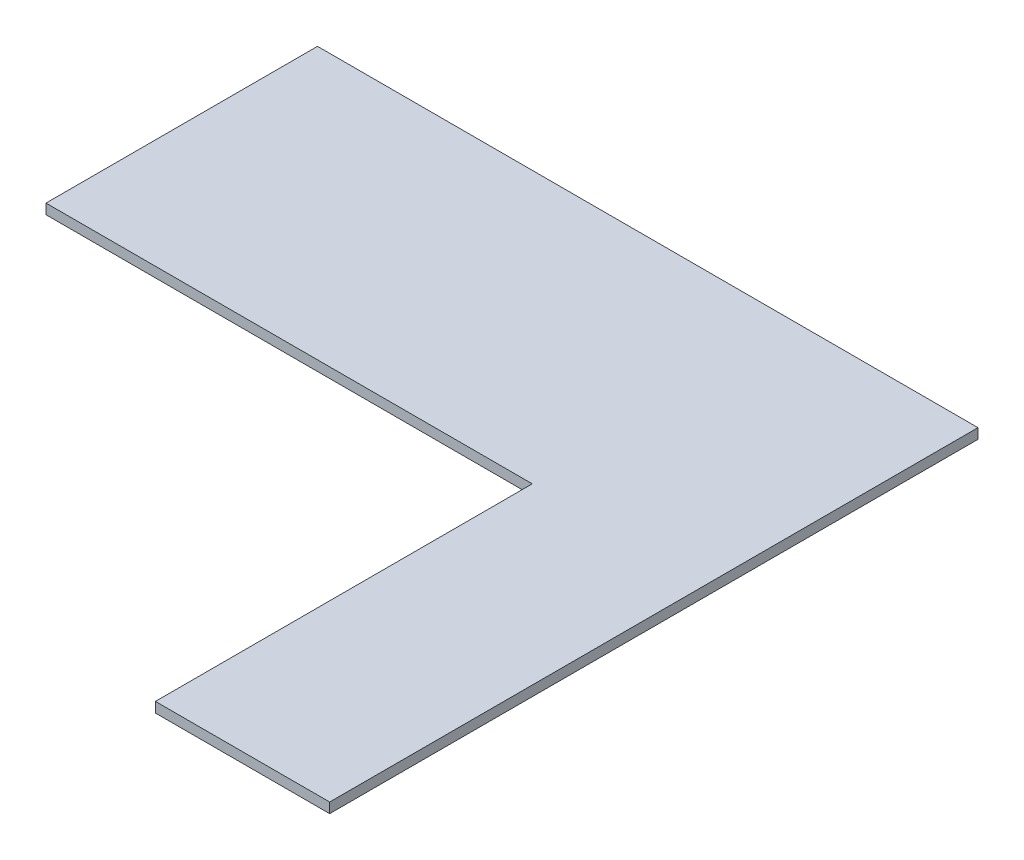
from build123d import *

# Parameters (mm, degrees)
EXTRUDE_1_DEPTH = 25


with BuildPart() as part:
    # Эскиз1 → Бобышка-Вытянуть1 (new body)
    with BuildSketch(Plane(origin=(0, 0, 0), x_dir=(1, 0, 0), z_dir=(0, 1, 0))):
        Polygon((0, 0), (0, 670), (1630, 670), (1630, -930), (1200, -930), (1200, 0), align=None)
    extrude(amount=EXTRUDE_1_DEPTH)


solid = part.part
